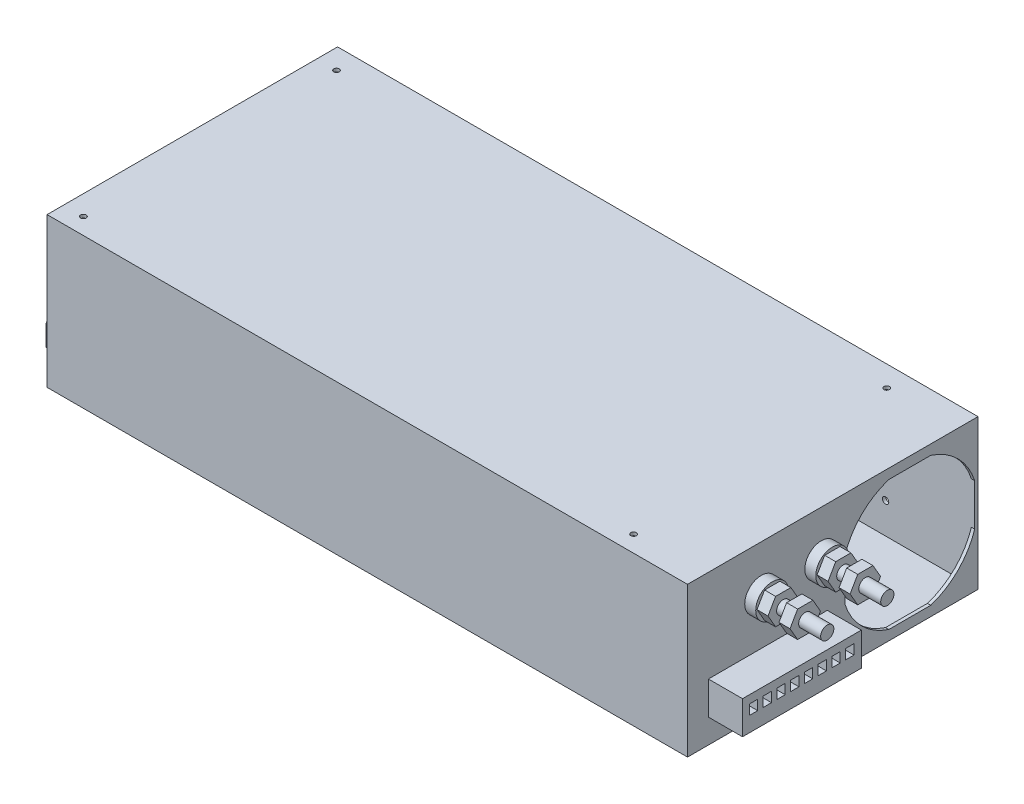
from build123d import *

# Parameters (mm, degrees)
SKETCH1_W                        = 291
SKETCH1_H                        = 132
BOSS_EXTRUDE1_DEPTH              = 68
SHELL1_T                         = 1.5
M3X0_5_TAPPED_HOLE1_D            = 2.5
M3X0_5_TAPPED_HOLE1_DEPTH        = 7.5
M3X0_5_TAPPED_HOLE1_TIP          = 0.751075774
CUT_EXTRUDE1_DEPTH               = 1.5
CUT_EXTRUDE2_DEPTH               = 1.5
BOSS_EXTRUDE2_DEPTH              = 0.1
SKETCH11_4_W                     = 1.5
SKETCH11_4_H                     = 11.5
SKETCH11_4_W_2                   = 10
BOSS_EXTRUDE3_DEPTH              = 5
SKETCH13_W                       = 1
SKETCH13_H                       = 14
EXTRUDE_THIN1_DEPTH              = 10
EXTRUDE_THIN1_DRAFT              = 1.5
EXTRUDE_THIN1_PROFILE_2_DEPTH    = 10
EXTRUDE_THIN1_PROFILE_2_DRAFT    = 1.5
EXTRUDE_THIN1_PROFILE_3_DEPTH    = 10
EXTRUDE_THIN1_PROFILE_3_DRAFT    = 1.5
EXTRUDE_THIN1_PROFILE_4_DEPTH    = 10
EXTRUDE_THIN1_PROFILE_4_DRAFT    = 1.5
FILLET1_R                        = 1.5
SKETCH14_R                       = 3.75
CUT_EXTRUDE3_DEPTH               = 3
SKETCH15_R                       = 3.5
BOSS_EXTRUDE4_DEPTH              = 3
FILLET2_R                        = 1.5
SKETCH16_W                       = 1
SKETCH16_H                       = 8.200088802
SKETCH16_W_2                     = 8.200088802
SKETCH16_H_2                     = 1
CUT_EXTRUDE_THIN4_DEPTH          = 2
LPATTERN1_COUNT                  = 3
LPATTERN1_PITCH                  = 10
SKETCH17_W                       = 54
SKETCH17_H                       = 15
BOSS_EXTRUDE5_DEPTH              = 15.5
SKETCH17_3_R                     = 3
BOSS_EXTRUDE6_DEPTH              = 30
SKETCH19_R                       = 7.5
BOSS_EXTRUDE7_DEPTH              = 5
SKETCH20_R                       = 3
BOSS_EXTRUDE8_DEPTH              = 5
BOSS_EXTRUDE8_2_DEPTH            = 5
LPATTERN2_COUNT                  = 2
LPATTERN2_PITCH                  = 10
SKETCH21_W                       = 3.75
SKETCH21_H                       = 4.5
CUT_EXTRUDE4_DEPTH               = 5
CUT_EXTRUDE5_START               = -1.5
CUT_EXTRUDE5_DEPTH               = 1.5
M3_5X0_6_TAPPED_HOLE2_AT_2_COUNT = 2
M3_5X0_6_TAPPED_HOLE2_AT_2_PITCH = 37
M3_5X0_6_TAPPED_HOLE2_AT_3_COUNT = 2
M3_5X0_6_TAPPED_HOLE2_AT_3_PITCH = 200
M3_5X0_6_TAPPED_HOLE2_AT_4_COUNT = 2
M3_5X0_6_TAPPED_HOLE2_AT_4_PITCH = 203.393706884
M3X0_5_TAPPED_HOLE3_AT_2_COUNT   = 2
M3X0_5_TAPPED_HOLE3_AT_2_PITCH   = 37
M3X0_5_TAPPED_HOLE3_AT_3_COUNT   = 2
M3X0_5_TAPPED_HOLE3_AT_3_PITCH   = 199.5
M3X0_5_TAPPED_HOLE3_AT_4_COUNT   = 2
M3X0_5_TAPPED_HOLE3_AT_4_PITCH   = 202.902069975


with BuildPart() as part:
    # Sketch1 → Boss-Extrude1 (new body)
    with BuildSketch(Plane(origin=(0, 0, 0), x_dir=(1, 0, 0), z_dir=(0, 1, 0))):
        Rectangle(SKETCH1_W, SKETCH1_H)
    extrude(amount=BOSS_EXTRUDE1_DEPTH)

    # Shell1 (no face opened: a closed hollow body)
    add(offset(amount=-SHELL1_T, mode=Mode.PRIVATE), mode=Mode.SUBTRACT)

    # M3x0.5 Tapped Hole1
    with Locations(Plane(origin=(0, 68, 0), x_dir=(1, 0, 0), z_dir=(0, 1, 0))):
        with Locations((-136.5, 56.5), (-136.5, -58.5), (113.5, -58.5), (113.5, 56.5)):
            Hole(M3X0_5_TAPPED_HOLE1_D / 2, depth=M3X0_5_TAPPED_HOLE1_DEPTH)
            with Locations((0, 0, -(M3X0_5_TAPPED_HOLE1_DEPTH + M3X0_5_TAPPED_HOLE1_TIP / 2))):  # 118° drill point
                Cone(0, M3X0_5_TAPPED_HOLE1_D / 2, M3X0_5_TAPPED_HOLE1_TIP, mode=Mode.SUBTRACT)

    # Sketch10 → Cut-Extrude1 (cut)
    with BuildSketch(Plane.XZ):
        with BuildLine():
            Line((-131.25, -59), (-115.25, -59))
            ThreePointArc((-115.25, -59), (-113.75, -60.5), (-115.25, -62))
            Line((-115.25, -62), (-131.25, -62))
            ThreePointArc((-131.25, -62), (-132.75, -60.5), (-131.25, -59))
        make_face()
        with BuildLine():
            Line((-104.75, -59), (-88.75, -59))
            ThreePointArc((-88.75, -59), (-87.25, -60.5), (-88.75, -62))
            Line((-88.75, -62), (-104.75, -62))
            ThreePointArc((-104.75, -62), (-106.25, -60.5), (-104.75, -59))
        make_face()
        with BuildLine():
            Line((-104.75, -54), (-88.75, -54))
            ThreePointArc((-88.75, -54), (-87.25, -55.5), (-88.75, -57))
            Line((-88.75, -57), (-104.75, -57))
            ThreePointArc((-104.75, -57), (-106.25, -55.5), (-104.75, -54))
        make_face()
        with BuildLine():
            Line((-104.75, -49), (-88.75, -49))
            ThreePointArc((-88.75, -49), (-87.25, -50.5), (-88.75, -52))
            Line((-88.75, -52), (-104.75, -52))
            ThreePointArc((-104.75, -52), (-106.25, -50.5), (-104.75, -49))
        make_face()
        with BuildLine():
            Line((-104.75, -44), (-88.75, -44))
            ThreePointArc((-88.75, -44), (-87.25, -45.5), (-88.75, -47))
            Line((-88.75, -47), (-104.75, -47))
            ThreePointArc((-104.75, -47), (-106.25, -45.5), (-104.75, -44))
        make_face()
        with BuildLine():
            Line((-104.75, -39), (-88.75, -39))
            ThreePointArc((-88.75, -39), (-87.25, -40.5), (-88.75, -42))
            Line((-88.75, -42), (-104.75, -42))
            ThreePointArc((-104.75, -42), (-106.25, -40.5), (-104.75, -39))
        make_face()
        with BuildLine():
            Line((-104.75, -34), (-88.75, -34))
            ThreePointArc((-88.75, -34), (-87.25, -35.5), (-88.75, -37))
            Line((-88.75, -37), (-104.75, -37))
            ThreePointArc((-104.75, -37), (-106.25, -35.5), (-104.75, -34))
        make_face()
        with BuildLine():
            Line((-104.75, -29), (-88.75, -29))
            ThreePointArc((-88.75, -29), (-87.25, -30.5), (-88.75, -32))
            Line((-88.75, -32), (-104.75, -32))
            ThreePointArc((-104.75, -32), (-106.25, -30.5), (-104.75, -29))
        make_face()
        with BuildLine():
            Line((-104.75, -24), (-88.75, -24))
            ThreePointArc((-88.75, -24), (-87.25, -25.5), (-88.75, -27))
            Line((-88.75, -27), (-104.75, -27))
            ThreePointArc((-104.75, -27), (-106.25, -25.5), (-104.75, -24))
        make_face()
        with BuildLine():
            Line((-104.75, -19), (-88.75, -19))
            ThreePointArc((-88.75, -19), (-87.25, -20.5), (-88.75, -22))
            Line((-88.75, -22), (-104.75, -22))
            ThreePointArc((-104.75, -22), (-106.25, -20.5), (-104.75, -19))
        make_face()
        with BuildLine():
            Line((-104.75, -14), (-88.75, -14))
            ThreePointArc((-88.75, -14), (-87.25, -15.5), (-88.75, -17))
            Line((-88.75, -17), (-104.75, -17))
            ThreePointArc((-104.75, -17), (-106.25, -15.5), (-104.75, -14))
        make_face()
        with BuildLine():
            Line((-104.75, -9), (-88.75, -9))
            ThreePointArc((-88.75, -9), (-87.25, -10.5), (-88.75, -12))
            Line((-88.75, -12), (-104.75, -12))
            ThreePointArc((-104.75, -12), (-106.25, -10.5), (-104.75, -9))
        make_face()
        with BuildLine():
            Line((-104.75, -4), (-88.75, -4))
            ThreePointArc((-88.75, -4), (-87.25, -5.5), (-88.75, -7))
            Line((-88.75, -7), (-104.75, -7))
            ThreePointArc((-104.75, -7), (-106.25, -5.5), (-104.75, -4))
        make_face()
        with BuildLine():
            Line((-104.75, 1), (-88.75, 1))
            ThreePointArc((-88.75, 1), (-87.25, -0.5), (-88.75, -2))
            Line((-88.75, -2), (-104.75, -2))
            ThreePointArc((-104.75, -2), (-106.25, -0.5), (-104.75, 1))
        make_face()
        with BuildLine():
            Line((-104.75, 6), (-88.75, 6))
            ThreePointArc((-88.75, 6), (-87.25, 4.5), (-88.75, 3))
            Line((-88.75, 3), (-104.75, 3))
            ThreePointArc((-104.75, 3), (-106.25, 4.5), (-104.75, 6))
        make_face()
        with BuildLine():
            Line((-104.75, 11), (-88.75, 11))
            ThreePointArc((-88.75, 11), (-87.25, 9.5), (-88.75, 8))
            Line((-88.75, 8), (-104.75, 8))
            ThreePointArc((-104.75, 8), (-106.25, 9.5), (-104.75, 11))
        make_face()
        with BuildLine():
            Line((-104.75, 16), (-88.75, 16))
            ThreePointArc((-88.75, 16), (-87.25, 14.5), (-88.75, 13))
            Line((-88.75, 13), (-104.75, 13))
            ThreePointArc((-104.75, 13), (-106.25, 14.5), (-104.75, 16))
        make_face()
        with BuildLine():
            Line((-104.75, 21), (-88.75, 21))
            ThreePointArc((-88.75, 21), (-87.25, 19.5), (-88.75, 18))
            Line((-88.75, 18), (-104.75, 18))
            ThreePointArc((-104.75, 18), (-106.25, 19.5), (-104.75, 21))
        make_face()
        with BuildLine():
            Line((-104.75, 26), (-88.75, 26))
            ThreePointArc((-88.75, 26), (-87.25, 24.5), (-88.75, 23))
            Line((-88.75, 23), (-104.75, 23))
            ThreePointArc((-104.75, 23), (-106.25, 24.5), (-104.75, 26))
        make_face()
        with BuildLine():
            Line((-104.75, 31), (-88.75, 31))
            ThreePointArc((-88.75, 31), (-87.25, 29.5), (-88.75, 28))
            Line((-88.75, 28), (-104.75, 28))
            ThreePointArc((-104.75, 28), (-106.25, 29.5), (-104.75, 31))
        make_face()
        with BuildLine():
            Line((-104.75, 36), (-88.75, 36))
            ThreePointArc((-88.75, 36), (-87.25, 34.5), (-88.75, 33))
            Line((-88.75, 33), (-104.75, 33))
            ThreePointArc((-104.75, 33), (-106.25, 34.5), (-104.75, 36))
        make_face()
        with BuildLine():
            Line((-104.75, 41), (-88.75, 41))
            ThreePointArc((-88.75, 41), (-87.25, 39.5), (-88.75, 38))
            Line((-88.75, 38), (-104.75, 38))
            ThreePointArc((-104.75, 38), (-106.25, 39.5), (-104.75, 41))
        make_face()
        with BuildLine():
            Line((-104.75, 46), (-88.75, 46))
            ThreePointArc((-88.75, 46), (-87.25, 44.5), (-88.75, 43))
            Line((-88.75, 43), (-104.75, 43))
            ThreePointArc((-104.75, 43), (-106.25, 44.5), (-104.75, 46))
        make_face()
        with BuildLine():
            Line((-104.75, 51), (-88.75, 51))
            ThreePointArc((-88.75, 51), (-87.25, 49.5), (-88.75, 48))
            Line((-88.75, 48), (-104.75, 48))
            ThreePointArc((-104.75, 48), (-106.25, 49.5), (-104.75, 51))
        make_face()
        with BuildLine():
            Line((-104.75, 56), (-88.75, 56))
            ThreePointArc((-88.75, 56), (-87.25, 54.5), (-88.75, 53))
            Line((-88.75, 53), (-104.75, 53))
            ThreePointArc((-104.75, 53), (-106.25, 54.5), (-104.75, 56))
        make_face()
        with BuildLine():
            Line((-104.75, 61), (-88.75, 61))
            ThreePointArc((-88.75, 61), (-87.25, 59.5), (-88.75, 58))
            Line((-88.75, 58), (-104.75, 58))
            ThreePointArc((-104.75, 58), (-106.25, 59.5), (-104.75, 61))
        make_face()
        with BuildLine():
            Line((-131.25, -54), (-115.25, -54))
            ThreePointArc((-115.25, -54), (-113.75, -55.5), (-115.25, -57))
            Line((-115.25, -57), (-131.25, -57))
            ThreePointArc((-131.25, -57), (-132.75, -55.5), (-131.25, -54))
        make_face()
        with BuildLine():
            Line((-131.25, -49), (-115.25, -49))
            ThreePointArc((-115.25, -49), (-113.75, -50.5), (-115.25, -52))
            Line((-115.25, -52), (-131.25, -52))
            ThreePointArc((-131.25, -52), (-132.75, -50.5), (-131.25, -49))
        make_face()
        with BuildLine():
            Line((-131.25, -44), (-115.25, -44))
            ThreePointArc((-115.25, -44), (-113.75, -45.5), (-115.25, -47))
            Line((-115.25, -47), (-131.25, -47))
            ThreePointArc((-131.25, -47), (-132.75, -45.5), (-131.25, -44))
        make_face()
        with BuildLine():
            Line((-131.25, -39), (-115.25, -39))
            ThreePointArc((-115.25, -39), (-113.75, -40.5), (-115.25, -42))
            Line((-115.25, -42), (-131.25, -42))
            ThreePointArc((-131.25, -42), (-132.75, -40.5), (-131.25, -39))
        make_face()
        with BuildLine():
            Line((-131.25, -34), (-115.25, -34))
            ThreePointArc((-115.25, -34), (-113.75, -35.5), (-115.25, -37))
            Line((-115.25, -37), (-131.25, -37))
            ThreePointArc((-131.25, -37), (-132.75, -35.5), (-131.25, -34))
        make_face()
        with BuildLine():
            Line((-131.25, -29), (-115.25, -29))
            ThreePointArc((-115.25, -29), (-113.75, -30.5), (-115.25, -32))
            Line((-115.25, -32), (-131.25, -32))
            ThreePointArc((-131.25, -32), (-132.75, -30.5), (-131.25, -29))
        make_face()
        with BuildLine():
            Line((-131.25, -24), (-115.25, -24))
            ThreePointArc((-115.25, -24), (-113.75, -25.5), (-115.25, -27))
            Line((-115.25, -27), (-131.25, -27))
            ThreePointArc((-131.25, -27), (-132.75, -25.5), (-131.25, -24))
        make_face()
        with BuildLine():
            Line((-131.25, -19), (-115.25, -19))
            ThreePointArc((-115.25, -19), (-113.75, -20.5), (-115.25, -22))
            Line((-115.25, -22), (-131.25, -22))
            ThreePointArc((-131.25, -22), (-132.75, -20.5), (-131.25, -19))
        make_face()
        with BuildLine():
            Line((-131.25, -14), (-115.25, -14))
            ThreePointArc((-115.25, -14), (-113.75, -15.5), (-115.25, -17))
            Line((-115.25, -17), (-131.25, -17))
            ThreePointArc((-131.25, -17), (-132.75, -15.5), (-131.25, -14))
        make_face()
        with BuildLine():
            Line((-131.25, -9), (-115.25, -9))
            ThreePointArc((-115.25, -9), (-113.75, -10.5), (-115.25, -12))
            Line((-115.25, -12), (-131.25, -12))
            ThreePointArc((-131.25, -12), (-132.75, -10.5), (-131.25, -9))
        make_face()
        with BuildLine():
            Line((-131.25, -4), (-115.25, -4))
            ThreePointArc((-115.25, -4), (-113.75, -5.5), (-115.25, -7))
            Line((-115.25, -7), (-131.25, -7))
            ThreePointArc((-131.25, -7), (-132.75, -5.5), (-131.25, -4))
        make_face()
        with BuildLine():
            Line((-131.25, 1), (-115.25, 1))
            ThreePointArc((-115.25, 1), (-113.75, -0.5), (-115.25, -2))
            Line((-115.25, -2), (-131.25, -2))
            ThreePointArc((-131.25, -2), (-132.75, -0.5), (-131.25, 1))
        make_face()
        with BuildLine():
            Line((-131.25, 6), (-115.25, 6))
            ThreePointArc((-115.25, 6), (-113.75, 4.5), (-115.25, 3))
            Line((-115.25, 3), (-131.25, 3))
            ThreePointArc((-131.25, 3), (-132.75, 4.5), (-131.25, 6))
        make_face()
        with BuildLine():
            Line((-131.25, 11), (-115.25, 11))
            ThreePointArc((-115.25, 11), (-113.75, 9.5), (-115.25, 8))
            Line((-115.25, 8), (-131.25, 8))
            ThreePointArc((-131.25, 8), (-132.75, 9.5), (-131.25, 11))
        make_face()
        with BuildLine():
            Line((-131.25, 16), (-115.25, 16))
            ThreePointArc((-115.25, 16), (-113.75, 14.5), (-115.25, 13))
            Line((-115.25, 13), (-131.25, 13))
            ThreePointArc((-131.25, 13), (-132.75, 14.5), (-131.25, 16))
        make_face()
        with BuildLine():
            Line((-131.25, 21), (-115.25, 21))
            ThreePointArc((-115.25, 21), (-113.75, 19.5), (-115.25, 18))
            Line((-115.25, 18), (-131.25, 18))
            ThreePointArc((-131.25, 18), (-132.75, 19.5), (-131.25, 21))
        make_face()
        with BuildLine():
            Line((-131.25, 26), (-115.25, 26))
            ThreePointArc((-115.25, 26), (-113.75, 24.5), (-115.25, 23))
            Line((-115.25, 23), (-131.25, 23))
            ThreePointArc((-131.25, 23), (-132.75, 24.5), (-131.25, 26))
        make_face()
        with BuildLine():
            Line((-131.25, 31), (-115.25, 31))
            ThreePointArc((-115.25, 31), (-113.75, 29.5), (-115.25, 28))
            Line((-115.25, 28), (-131.25, 28))
            ThreePointArc((-131.25, 28), (-132.75, 29.5), (-131.25, 31))
        make_face()
        with BuildLine():
            Line((-131.25, 36), (-115.25, 36))
            ThreePointArc((-115.25, 36), (-113.75, 34.5), (-115.25, 33))
            Line((-115.25, 33), (-131.25, 33))
            ThreePointArc((-131.25, 33), (-132.75, 34.5), (-131.25, 36))
        make_face()
        with BuildLine():
            Line((-131.25, 41), (-115.25, 41))
            ThreePointArc((-115.25, 41), (-113.75, 39.5), (-115.25, 38))
            Line((-115.25, 38), (-131.25, 38))
            ThreePointArc((-131.25, 38), (-132.75, 39.5), (-131.25, 41))
        make_face()
        with BuildLine():
            Line((-131.25, 46), (-115.25, 46))
            ThreePointArc((-115.25, 46), (-113.75, 44.5), (-115.25, 43))
            Line((-115.25, 43), (-131.25, 43))
            ThreePointArc((-131.25, 43), (-132.75, 44.5), (-131.25, 46))
        make_face()
        with BuildLine():
            Line((-131.25, 51), (-115.25, 51))
            ThreePointArc((-115.25, 51), (-113.75, 49.5), (-115.25, 48))
            Line((-115.25, 48), (-131.25, 48))
            ThreePointArc((-131.25, 48), (-132.75, 49.5), (-131.25, 51))
        make_face()
        with BuildLine():
            Line((-131.25, 56), (-115.25, 56))
            ThreePointArc((-115.25, 56), (-113.75, 54.5), (-115.25, 53))
            Line((-115.25, 53), (-131.25, 53))
            ThreePointArc((-131.25, 53), (-132.75, 54.5), (-131.25, 56))
        make_face()
        with BuildLine():
            Line((-131.25, 61), (-115.25, 61))
            ThreePointArc((-115.25, 61), (-113.75, 59.5), (-115.25, 58))
            Line((-115.25, 58), (-131.25, 58))
            ThreePointArc((-131.25, 58), (-132.75, 59.5), (-131.25, 61))
        make_face()
    extrude(amount=-CUT_EXTRUDE1_DEPTH, mode=Mode.SUBTRACT)

    # Sketch11 → Cut-Extrude2 (cut)
    with BuildSketch(Plane.ZY.offset(145.5)):
        with BuildLine():
            Line((3.5, 11.75), (3.5, 27.75))
            ThreePointArc((3.5, 27.75), (2, 29.25), (0.5, 27.75))
            Line((0.5, 27.75), (0.5, 11.75))
            ThreePointArc((0.5, 11.75), (2, 10.25), (3.5, 11.75))
        make_face()
        with BuildLine():
            Line((-1.5, 11.75), (-1.5, 27.75))
            ThreePointArc((-1.5, 27.75), (-3, 29.25), (-4.5, 27.75))
            Line((-4.5, 27.75), (-4.5, 11.75))
            ThreePointArc((-4.5, 11.75), (-3, 10.25), (-1.5, 11.75))
        make_face()
        with BuildLine():
            Line((-6.5, 11.75), (-6.5, 27.75))
            ThreePointArc((-6.5, 27.75), (-8, 29.25), (-9.5, 27.75))
            Line((-9.5, 27.75), (-9.5, 11.75))
            ThreePointArc((-9.5, 11.75), (-8, 10.25), (-6.5, 11.75))
        make_face()
        with BuildLine():
            Line((-11.5, 11.75), (-11.5, 27.75))
            ThreePointArc((-11.5, 27.75), (-13, 29.25), (-14.5, 27.75))
            Line((-14.5, 27.75), (-14.5, 11.75))
            ThreePointArc((-14.5, 11.75), (-13, 10.25), (-11.5, 11.75))
        make_face()
        with BuildLine():
            Line((-16.5, 11.75), (-16.5, 27.75))
            ThreePointArc((-16.5, 27.75), (-18, 29.25), (-19.5, 27.75))
            Line((-19.5, 27.75), (-19.5, 11.75))
            ThreePointArc((-19.5, 11.75), (-18, 10.25), (-16.5, 11.75))
        make_face()
        with BuildLine():
            Line((-21.5, 11.75), (-21.5, 27.75))
            ThreePointArc((-21.5, 27.75), (-23, 29.25), (-24.5, 27.75))
            Line((-24.5, 27.75), (-24.5, 11.75))
            ThreePointArc((-24.5, 11.75), (-23, 10.25), (-21.5, 11.75))
        make_face()
        with BuildLine():
            Line((-26.5, 11.75), (-26.5, 27.75))
            ThreePointArc((-26.5, 27.75), (-28, 29.25), (-29.5, 27.75))
            Line((-29.5, 27.75), (-29.5, 11.75))
            ThreePointArc((-29.5, 11.75), (-28, 10.25), (-26.5, 11.75))
        make_face()
        with BuildLine():
            Line((-31.5, 11.75), (-31.5, 27.75))
            ThreePointArc((-31.5, 27.75), (-33, 29.25), (-34.5, 27.75))
            Line((-34.5, 27.75), (-34.5, 11.75))
            ThreePointArc((-34.5, 11.75), (-33, 10.25), (-31.5, 11.75))
        make_face()
        with BuildLine():
            Line((-36.5, 11.75), (-36.5, 27.75))
            ThreePointArc((-36.5, 27.75), (-38, 29.25), (-39.5, 27.75))
            Line((-39.5, 27.75), (-39.5, 11.75))
            ThreePointArc((-39.5, 11.75), (-38, 10.25), (-36.5, 11.75))
        make_face()
        with BuildLine():
            Line((-41.5, 11.75), (-41.5, 27.75))
            ThreePointArc((-41.5, 27.75), (-43, 29.25), (-44.5, 27.75))
            Line((-44.5, 27.75), (-44.5, 11.75))
            ThreePointArc((-44.5, 11.75), (-43, 10.25), (-41.5, 11.75))
        make_face()
        with BuildLine():
            Line((-46.5, 11.75), (-46.5, 27.75))
            ThreePointArc((-46.5, 27.75), (-48, 29.25), (-49.5, 27.75))
            Line((-49.5, 27.75), (-49.5, 11.75))
            ThreePointArc((-49.5, 11.75), (-48, 10.25), (-46.5, 11.75))
        make_face()
        with BuildLine():
            Line((-51.5, 11.75), (-51.5, 27.75))
            ThreePointArc((-51.5, 27.75), (-53, 29.25), (-54.5, 27.75))
            Line((-54.5, 27.75), (-54.5, 11.75))
            ThreePointArc((-54.5, 11.75), (-53, 10.25), (-51.5, 11.75))
        make_face()
        with BuildLine():
            Line((-56.5, 11.75), (-56.5, 27.75))
            ThreePointArc((-56.5, 27.75), (-58, 29.25), (-59.5, 27.75))
            Line((-59.5, 27.75), (-59.5, 11.75))
            ThreePointArc((-59.5, 11.75), (-58, 10.25), (-56.5, 11.75))
        make_face()
        with BuildLine():
            Line((-46.5, 37.25), (-46.5, 53.25))
            ThreePointArc((-46.5, 53.25), (-48, 54.75), (-49.5, 53.25))
            Line((-49.5, 53.25), (-49.5, 37.25))
            ThreePointArc((-49.5, 37.25), (-48, 35.75), (-46.5, 37.25))
        make_face()
        with BuildLine():
            Line((-41.5, 37.25), (-41.5, 53.25))
            ThreePointArc((-41.5, 53.25), (-43, 54.75), (-44.5, 53.25))
            Line((-44.5, 53.25), (-44.5, 37.25))
            ThreePointArc((-44.5, 37.25), (-43, 35.75), (-41.5, 37.25))
        make_face()
        with BuildLine():
            Line((-36.5, 37.25), (-36.5, 53.25))
            ThreePointArc((-36.5, 53.25), (-38, 54.75), (-39.5, 53.25))
            Line((-39.5, 53.25), (-39.5, 37.25))
            ThreePointArc((-39.5, 37.25), (-38, 35.75), (-36.5, 37.25))
        make_face()
        with BuildLine():
            Line((-31.5, 37.25), (-31.5, 53.25))
            ThreePointArc((-31.5, 53.25), (-33, 54.75), (-34.5, 53.25))
            Line((-34.5, 53.25), (-34.5, 37.25))
            ThreePointArc((-34.5, 37.25), (-33, 35.75), (-31.5, 37.25))
        make_face()
        with BuildLine():
            Line((-26.5, 37.25), (-26.5, 53.25))
            ThreePointArc((-26.5, 53.25), (-28, 54.75), (-29.5, 53.25))
            Line((-29.5, 53.25), (-29.5, 37.25))
            ThreePointArc((-29.5, 37.25), (-28, 35.75), (-26.5, 37.25))
        make_face()
        with BuildLine():
            Line((-21.5, 37.25), (-21.5, 53.25))
            ThreePointArc((-21.5, 53.25), (-23, 54.75), (-24.5, 53.25))
            Line((-24.5, 53.25), (-24.5, 37.25))
            ThreePointArc((-24.5, 37.25), (-23, 35.75), (-21.5, 37.25))
        make_face()
        with BuildLine():
            Line((-16.5, 37.25), (-16.5, 53.25))
            ThreePointArc((-16.5, 53.25), (-18, 54.75), (-19.5, 53.25))
            Line((-19.5, 53.25), (-19.5, 37.25))
            ThreePointArc((-19.5, 37.25), (-18, 35.75), (-16.5, 37.25))
        make_face()
        with BuildLine():
            Line((-11.5, 37.25), (-11.5, 53.25))
            ThreePointArc((-11.5, 53.25), (-13, 54.75), (-14.5, 53.25))
            Line((-14.5, 53.25), (-14.5, 37.25))
            ThreePointArc((-14.5, 37.25), (-13, 35.75), (-11.5, 37.25))
        make_face()
        with BuildLine():
            Line((-6.5, 37.25), (-6.5, 53.25))
            ThreePointArc((-6.5, 53.25), (-8, 54.75), (-9.5, 53.25))
            Line((-9.5, 53.25), (-9.5, 37.25))
            ThreePointArc((-9.5, 37.25), (-8, 35.75), (-6.5, 37.25))
        make_face()
        with BuildLine():
            Line((-1.5, 37.25), (-1.5, 53.25))
            ThreePointArc((-1.5, 53.25), (-3, 54.75), (-4.5, 53.25))
            Line((-4.5, 53.25), (-4.5, 37.25))
            ThreePointArc((-4.5, 37.25), (-3, 35.75), (-1.5, 37.25))
        make_face()
        with BuildLine():
            Line((3.5, 37.25), (3.5, 53.25))
            ThreePointArc((3.5, 53.25), (2, 54.75), (0.5, 53.25))
            Line((0.5, 53.25), (0.5, 37.25))
            ThreePointArc((0.5, 37.25), (2, 35.75), (3.5, 37.25))
        make_face()
        with BuildLine():
            Line((8.5, 37.25), (8.5, 53.25))
            ThreePointArc((8.5, 53.25), (7, 54.75), (5.5, 53.25))
            Line((5.5, 53.25), (5.5, 37.25))
            ThreePointArc((5.5, 37.25), (7, 35.75), (8.5, 37.25))
        make_face()
        with BuildLine():
            Line((13.5, 37.25), (13.5, 53.25))
            ThreePointArc((13.5, 53.25), (12, 54.75), (10.5, 53.25))
            Line((10.5, 53.25), (10.5, 37.25))
            ThreePointArc((10.5, 37.25), (12, 35.75), (13.5, 37.25))
        make_face()
        with BuildLine():
            Line((18.5, 37.25), (18.5, 53.25))
            ThreePointArc((18.5, 53.25), (17, 54.75), (15.5, 53.25))
            Line((15.5, 53.25), (15.5, 37.25))
            ThreePointArc((15.5, 37.25), (17, 35.75), (18.5, 37.25))
        make_face()
        with BuildLine():
            Line((23.5, 37.25), (23.5, 53.25))
            ThreePointArc((23.5, 53.25), (22, 54.75), (20.5, 53.25))
            Line((20.5, 53.25), (20.5, 37.25))
            ThreePointArc((20.5, 37.25), (22, 35.75), (23.5, 37.25))
        make_face()
        with BuildLine():
            Line((28.5, 37.25), (28.5, 53.25))
            ThreePointArc((28.5, 53.25), (27, 54.75), (25.5, 53.25))
            Line((25.5, 53.25), (25.5, 37.25))
            ThreePointArc((25.5, 37.25), (27, 35.75), (28.5, 37.25))
        make_face()
        with BuildLine():
            Line((33.5, 37.25), (33.5, 53.25))
            ThreePointArc((33.5, 53.25), (32, 54.75), (30.5, 53.25))
            Line((30.5, 53.25), (30.5, 37.25))
            ThreePointArc((30.5, 37.25), (32, 35.75), (33.5, 37.25))
        make_face()
        with BuildLine():
            Line((38.5, 37.25), (38.5, 53.25))
            ThreePointArc((38.5, 53.25), (37, 54.75), (35.5, 53.25))
            Line((35.5, 53.25), (35.5, 37.25))
            ThreePointArc((35.5, 37.25), (37, 35.75), (38.5, 37.25))
        make_face()
        with BuildLine():
            Line((43.5, 37.25), (43.5, 53.25))
            ThreePointArc((43.5, 53.25), (42, 54.75), (40.5, 53.25))
            Line((40.5, 53.25), (40.5, 37.25))
            ThreePointArc((40.5, 37.25), (42, 35.75), (43.5, 37.25))
        make_face()
        with BuildLine():
            Line((48.5, 37.25), (48.5, 53.25))
            ThreePointArc((48.5, 53.25), (47, 54.75), (45.5, 53.25))
            Line((45.5, 53.25), (45.5, 37.25))
            ThreePointArc((45.5, 37.25), (47, 35.75), (48.5, 37.25))
        make_face()
        with BuildLine():
            Line((53.5, 37.25), (53.5, 53.25))
            ThreePointArc((53.5, 53.25), (52, 54.75), (50.5, 53.25))
            Line((50.5, 53.25), (50.5, 37.25))
            ThreePointArc((50.5, 37.25), (52, 35.75), (53.5, 37.25))
        make_face()
    extrude(amount=-CUT_EXTRUDE2_DEPTH, mode=Mode.SUBTRACT)

    # Sketch11<3> → Boss-Extrude2 (add)
    with BuildSketch(Plane.ZY.offset(145.5)):
        with BuildLine():
            Line((50, 21.5), (54, 21.5))
            Line((54, 21.5), (54, 26.5))
            ThreePointArc((54, 26.5), (53.121320344, 28.621320344), (51, 29.5))
            Line((51, 29.5), (19, 29.5))
            ThreePointArc((19, 29.5), (16.878679656, 28.621320344), (16, 26.5))
            Line((16, 26.5), (16, 21.5))
            Line((16, 21.5), (20, 21.5))
            Line((20, 21.5), (30, 21.5))
            Line((30, 21.5), (40, 21.5))
            Line((40, 21.5), (50, 21.5))
        make_face()
        with BuildLine():
            Line((54, 5), (54, 10))
            Line((54, 10), (50, 10))
            Line((50, 10), (40, 10))
            Line((40, 10), (30, 10))
            Line((30, 10), (20, 10))
            Line((20, 10), (16, 10))
            Line((16, 10), (16, 5))
            ThreePointArc((16, 5), (16.878679656, 2.878679656), (19, 2))
            Line((19, 2), (51, 2))
            ThreePointArc((51, 2), (53.121320344, 2.878679656), (54, 5))
        make_face()
    extrude(amount=BOSS_EXTRUDE2_DEPTH)

    # Sketch11<4> → Boss-Extrude3 (add)
    with BuildSketch(Plane.ZY.offset(145.5)):
        with Locations((60.75, 15.75)):
            Rectangle(SKETCH11_4_W, SKETCH11_4_H)
        with Locations((55, 15.75)):
            Rectangle(SKETCH11_4_W_2, SKETCH11_4_H)
        with Locations((45, 15.75)):
            Rectangle(SKETCH11_4_W_2, SKETCH11_4_H)
        with Locations((35, 15.75)):
            Rectangle(SKETCH11_4_W_2, SKETCH11_4_H)
        with Locations((25, 15.75)):
            Rectangle(SKETCH11_4_W_2, SKETCH11_4_H)
        with Locations((15, 15.75)):
            Rectangle(SKETCH11_4_W_2, SKETCH11_4_H)
        with Locations((9.25, 15.75)):
            Rectangle(SKETCH11_4_W, SKETCH11_4_H)
    extrude(amount=BOSS_EXTRUDE3_DEPTH)


with BuildPart() as extrude_thin1_tool:
    # Sketch13 → Extrude-Thin1 (with draft: the straight prism first)
    with BuildSketch(Plane.ZY.offset(145.5)):
        with Locations((50.5, 15.75)):
            Rectangle(SKETCH13_W, SKETCH13_H)
    extrude(amount=EXTRUDE_THIN1_DEPTH)
    # Extrude-Thin1: the draft: its side faces are tilted about the plane it starts from
    extrude_thin1_sides = [extrude_thin1_tool.faces().sort_by_distance(p)[0] for p in [
        (-150.5, 8.75, 50.5),
        (-150.5, 15.75, 51),
        (-150.5, 22.75, 50.5),
        (-150.5, 15.75, 50),
    ]]
    draft(extrude_thin1_sides, Plane.ZY.offset(145.5), EXTRUDE_THIN1_DRAFT)


with BuildPart() as part_1:
    add(part.part)

    # Extrude-Thin1: add extrude_thin1_tool
    add(extrude_thin1_tool.part)


with BuildPart() as extrude_thin1_profile_2_tool:
    # Sketch13 → Extrude-Thin1 profile 2 (with draft: the straight prism first)
    with BuildSketch(Plane.ZY.offset(145.5)):
        with Locations((40.5, 15.75)):
            Rectangle(SKETCH13_W, SKETCH13_H)
    extrude(amount=EXTRUDE_THIN1_PROFILE_2_DEPTH)
    # Extrude-Thin1 profile 2: the draft: its side faces are tilted about the plane it starts from
    extrude_thin1_profile_2_sides = [extrude_thin1_profile_2_tool.faces().sort_by_distance(p)[0] for p in [
        (-150.5, 8.75, 40.5),
        (-150.5, 15.75, 41),
        (-150.5, 22.75, 40.5),
        (-150.5, 15.75, 40),
    ]]
    draft(extrude_thin1_profile_2_sides, Plane.ZY.offset(145.5), EXTRUDE_THIN1_PROFILE_2_DRAFT)


with BuildPart() as part_2:
    add(part_1.part)

    # Extrude-Thin1 profile 2: add extrude_thin1_profile_2_tool
    add(extrude_thin1_profile_2_tool.part)


with BuildPart() as extrude_thin1_profile_3_tool:
    # Sketch13 → Extrude-Thin1 profile 3 (with draft: the straight prism first)
    with BuildSketch(Plane.ZY.offset(145.5)):
        with Locations((30.5, 15.75)):
            Rectangle(SKETCH13_W, SKETCH13_H)
    extrude(amount=EXTRUDE_THIN1_PROFILE_3_DEPTH)
    # Extrude-Thin1 profile 3: the draft: its side faces are tilted about the plane it starts from
    extrude_thin1_profile_3_sides = [extrude_thin1_profile_3_tool.faces().sort_by_distance(p)[0] for p in [
        (-150.5, 8.75, 30.5),
        (-150.5, 15.75, 31),
        (-150.5, 22.75, 30.5),
        (-150.5, 15.75, 30),
    ]]
    draft(extrude_thin1_profile_3_sides, Plane.ZY.offset(145.5), EXTRUDE_THIN1_PROFILE_3_DRAFT)


with BuildPart() as part_3:
    add(part_2.part)

    # Extrude-Thin1 profile 3: add extrude_thin1_profile_3_tool
    add(extrude_thin1_profile_3_tool.part)


with BuildPart() as extrude_thin1_profile_4_tool:
    # Sketch13 → Extrude-Thin1 profile 4 (with draft: the straight prism first)
    with BuildSketch(Plane.ZY.offset(145.5)):
        with Locations((20.5, 15.75)):
            Rectangle(SKETCH13_W, SKETCH13_H)
    extrude(amount=EXTRUDE_THIN1_PROFILE_4_DEPTH)
    # Extrude-Thin1 profile 4: the draft: its side faces are tilted about the plane it starts from
    extrude_thin1_profile_4_sides = [extrude_thin1_profile_4_tool.faces().sort_by_distance(p)[0] for p in [
        (-150.5, 8.75, 20.5),
        (-150.5, 15.75, 21),
        (-150.5, 22.75, 20.5),
        (-150.5, 15.75, 20),
    ]]
    draft(extrude_thin1_profile_4_sides, Plane.ZY.offset(145.5), EXTRUDE_THIN1_PROFILE_4_DRAFT)


with BuildPart() as part_4:
    add(part_3.part)

    # Extrude-Thin1 profile 4: add extrude_thin1_profile_4_tool
    add(extrude_thin1_profile_4_tool.part)

    # Fillet1
    fillet1_edges = [part_4.edges().sort_by_distance(p)[0] for p in [
        (-148, 10, 8.5),
        (-148, 10, 61.5),
        (-148, 21.5, 61.5),
        (-148, 21.5, 8.5),
    ]]
    fillet(fillet1_edges, radius=FILLET1_R)

    # Sketch14 → Cut-Extrude3 (cut)
    with BuildSketch(Plane.ZY.offset(150.5)):
        with Locations((56, 15.75)):
            Circle(SKETCH14_R)
        with Locations(Location((15, 15.75, 0), (0, 0, 180))):
            Circle(SKETCH14_R)
    extrude(amount=-CUT_EXTRUDE3_DEPTH, mode=Mode.SUBTRACT)

    # Sketch17 → Boss-Extrude5 (add)
    with BuildSketch(Plane(origin=(145.5, 0, 0), x_dir=(0, 0, -1), z_dir=(1, 0, 0))):
        with Locations((-29.5, 18.5)):
            Rectangle(SKETCH17_W, SKETCH17_H)
    extrude(amount=BOSS_EXTRUDE5_DEPTH)

    # Sketch17<3> → Boss-Extrude6 (add)
    with BuildSketch(Plane(origin=(145.5, 0, 0), x_dir=(0, 0, -1), z_dir=(1, 0, 0))):
        with Locations(Location((-5.2, 47.25, 0), (0, 0, 180))):
            Circle(SKETCH17_3_R)
        with Locations(Location((-32.5, 47.25, 0), (0, 0, 180))):
            Circle(SKETCH17_3_R)
    extrude(amount=BOSS_EXTRUDE6_DEPTH)

    # Sketch19 → Boss-Extrude7 (add)
    with BuildSketch(Plane(origin=(145.5, 0, 0), x_dir=(0, 0, -1), z_dir=(1, 0, 0))):
        with Locations(Location((-5.2, 47.25, 0), (0, 0, 180))):
            Circle(SKETCH19_R)
        with Locations(Location((-32.5, 47.25, 0), (0, 0, 180))):
            Circle(SKETCH19_R)
    extrude(amount=BOSS_EXTRUDE7_DEPTH)

    # Sketch21 → Cut-Extrude4 (cut)
    with BuildSketch(Plane(origin=(161, 0, 0), x_dir=(0, 0, -1), z_dir=(1, 0, 0))):
        with Locations((-45.225, 20.1)):
            Rectangle(SKETCH21_W, SKETCH21_H)
        with Locations((-51.475, 20.1)):
            Rectangle(SKETCH21_W, SKETCH21_H)
        with Locations((-38.975, 20.1)):
            Rectangle(SKETCH21_W, SKETCH21_H)
        with Locations((-32.725, 20.1)):
            Rectangle(SKETCH21_W, SKETCH21_H)
        with Locations((-26.475, 20.1)):
            Rectangle(SKETCH21_W, SKETCH21_H)
        with Locations((-20.225, 20.1)):
            Rectangle(SKETCH21_W, SKETCH21_H)
        with Locations((-13.975, 20.1)):
            Rectangle(SKETCH21_W, SKETCH21_H)
        with Locations((-7.725, 20.1)):
            Rectangle(SKETCH21_W, SKETCH21_H)
    extrude(amount=-CUT_EXTRUDE4_DEPTH, mode=Mode.SUBTRACT)

    # Cut-Extrude5: read off the stored shape, not the designer's step
    # Cut-Extrude5 outline → Cut-Extrude5 (cut)
    with BuildSketch(Plane(origin=(145.5, 0, 0), x_dir=(0, 0, -1), z_dir=(1, 0, 0)).offset(CUT_EXTRUDE5_START)):
        with BuildLine():
            Line((64.5, 24.473720558), (64.5, 43.526279442))
            ThreePointArc((64.5, 43.526279442), (56.920310217, 55.920310217), (44.526279442, 63.5))
            Line((44.526279442, 63.5), (25.473720558, 63.5))
            ThreePointArc((25.473720558, 63.5), (13.079689783, 55.920310217), (5.5, 43.526279442))
            Line((5.5, 43.526279442), (5.5, 24.473720558))
            ThreePointArc((5.5, 24.473720558), (13.079689783, 12.079689783), (25.473720558, 4.5))
            Line((25.473720558, 4.5), (44.526279442, 4.5))
            ThreePointArc((44.526279442, 4.5), (56.920310217, 12.079689783), (64.5, 24.473720558))
        make_face()
    extrude(amount=CUT_EXTRUDE5_DEPTH, mode=Mode.SUBTRACT)

    # Sketch28 → M3.5x0.6 Tapped Hole2 (revolve, cut)
    with BuildSketch(Plane(origin=(-95, 52.5, -66), x_dir=(0, 1, 0), z_dir=(1, 0, 0))):
        Polygon((0, 0), (0, 9.671247898), (1.45, 8.8), (1.45, 0), align=None)
    m3_5x0_6_tapped_hole2 = revolve(axis=Axis((-95, 52.5, -72.35), (0, 0, 1)), mode=Mode.SUBTRACT)

    # M3.5x0.6 Tapped Hole2 at 2: M3.5x0.6 Tapped Hole2 ×2
    with Locations(*[(0, -i * M3_5X0_6_TAPPED_HOLE2_AT_2_PITCH, 0) for i in range(1, M3_5X0_6_TAPPED_HOLE2_AT_2_COUNT)]):
        add(m3_5x0_6_tapped_hole2, mode=Mode.SUBTRACT)

    # M3.5x0.6 Tapped Hole2 at 3: M3.5x0.6 Tapped Hole2 ×2
    with Locations(*[(i * M3_5X0_6_TAPPED_HOLE2_AT_3_PITCH, 0, 0) for i in range(1, M3_5X0_6_TAPPED_HOLE2_AT_3_COUNT)]):
        add(m3_5x0_6_tapped_hole2, mode=Mode.SUBTRACT)

    # M3.5x0.6 Tapped Hole2 at 4: M3.5x0.6 Tapped Hole2 ×2
    with Locations(*[Vector(0.983314592491789, -0.1819131996109878, 0) * (i * M3_5X0_6_TAPPED_HOLE2_AT_4_PITCH) for i in range(1, M3_5X0_6_TAPPED_HOLE2_AT_4_COUNT)]):
        add(m3_5x0_6_tapped_hole2, mode=Mode.SUBTRACT)

    # Sketch30 → M3x0.5 Tapped Hole3 (revolve, cut)
    with BuildSketch(Plane(origin=(-104.5, 52.5, -66), x_dir=(0, 1, 0), z_dir=(1, 0, 0))):
        Polygon((0, 0), (0, 8.251075774), (1.25, 7.5), (1.25, 0), align=None)
    m3x0_5_tapped_hole3 = revolve(axis=Axis((-104.5, 52.5, -72.35), (0, 0, 1)), mode=Mode.SUBTRACT)

    # M3x0.5 Tapped Hole3 at 2: M3x0.5 Tapped Hole3 ×2
    with Locations(*[(0, -i * M3X0_5_TAPPED_HOLE3_AT_2_PITCH, 0) for i in range(1, M3X0_5_TAPPED_HOLE3_AT_2_COUNT)]):
        add(m3x0_5_tapped_hole3, mode=Mode.SUBTRACT)

    # M3x0.5 Tapped Hole3 at 3: M3x0.5 Tapped Hole3 ×2
    with Locations(*[(i * M3X0_5_TAPPED_HOLE3_AT_3_PITCH, 0, 0) for i in range(1, M3X0_5_TAPPED_HOLE3_AT_3_COUNT)]):
        add(m3x0_5_tapped_hole3, mode=Mode.SUBTRACT)

    # M3x0.5 Tapped Hole3 at 4: M3x0.5 Tapped Hole3 ×2
    with Locations(*[Vector(0.9832329459473702, -0.18235397995013913, 0) * (i * M3X0_5_TAPPED_HOLE3_AT_4_PITCH) for i in range(1, M3X0_5_TAPPED_HOLE3_AT_4_COUNT)]):
        add(m3x0_5_tapped_hole3, mode=Mode.SUBTRACT)


with BuildPart() as body_2:
    # Sketch15 → Boss-Extrude4 (new body)
    with BuildSketch(Plane.ZY.offset(150.5)):
        with Locations((45.5, 15.75)):
            Circle(SKETCH15_R)
    extrude(amount=BOSS_EXTRUDE4_DEPTH)

    # Fillet2
    fillet2_edges = [body_2.edges().sort_by_distance(p)[0] for p in [
        (-153.5, 15.75, 42),
    ]]
    fillet(fillet2_edges, radius=FILLET2_R)

    # Sketch16 → Cut-Extrude-Thin4 (cut)
    with BuildSketch(Plane.ZY.offset(153.5)):
        with Locations((45.5, 15.75)):
            Rectangle(SKETCH16_W, SKETCH16_H)
        with Locations((45.5, 15.75)):
            Rectangle(SKETCH16_W_2, SKETCH16_H_2)
    extrude(amount=-CUT_EXTRUDE_THIN4_DEPTH, mode=Mode.SUBTRACT)


with BuildPart() as lpattern1_1:
    # LPattern1: pattern copy
    add(body_2.part.moved(Location(Vector(0, 0, -1) * (1 * LPATTERN1_PITCH))))


with BuildPart() as lpattern1_2:
    # LPattern1: pattern copy
    add(body_2.part.moved(Location(Vector(0, 0, -1) * (2 * LPATTERN1_PITCH))))


with BuildPart() as body_5:
    # Sketch20 → Boss-Extrude8 (new body)
    with BuildSketch(Plane(origin=(150.5, 0, 0), x_dir=(0, 0, -1), z_dir=(1, 0, 0))):
        Polygon((-35.964101615, 53.25), (-39.42820323, 47.25), (-35.964101615, 41.25), (-29.035898385, 41.25), (-25.57179677, 47.25), (-29.035898385, 53.25), align=None)
        with Locations((-32.5, 47.25)):
            Circle(SKETCH20_R, mode=Mode.SUBTRACT)
    extrude(amount=BOSS_EXTRUDE8_DEPTH)


with BuildPart() as body_6:
    # Sketch20 → Boss-Extrude8 2 (new body)
    with BuildSketch(Plane(origin=(150.5, 0, 0), x_dir=(0, 0, -1), z_dir=(1, 0, 0))):
        Polygon((-1.735898385, 53.25), (-8.664101615, 53.25), (-12.12820323, 47.25), (-8.664101615, 41.25), (-1.735898385, 41.25), (1.72820323, 47.25), align=None)
        with Locations((-5.2, 47.25)):
            Circle(SKETCH20_R, mode=Mode.SUBTRACT)
    extrude(amount=BOSS_EXTRUDE8_2_DEPTH)


with BuildPart() as lpattern2_1:
    # LPattern2: pattern copy
    add(body_6.part.moved(Location(Vector(1, 0, 0) * (1 * LPATTERN2_PITCH))))


with BuildPart() as lpattern2_2:
    # LPattern2: pattern copy
    add(body_5.part.moved(Location(Vector(1, 0, 0) * (1 * LPATTERN2_PITCH))))


solid = Compound([part_4.part, body_2.part, lpattern1_1.part, lpattern1_2.part, body_5.part, body_6.part, lpattern2_1.part, lpattern2_2.part])
